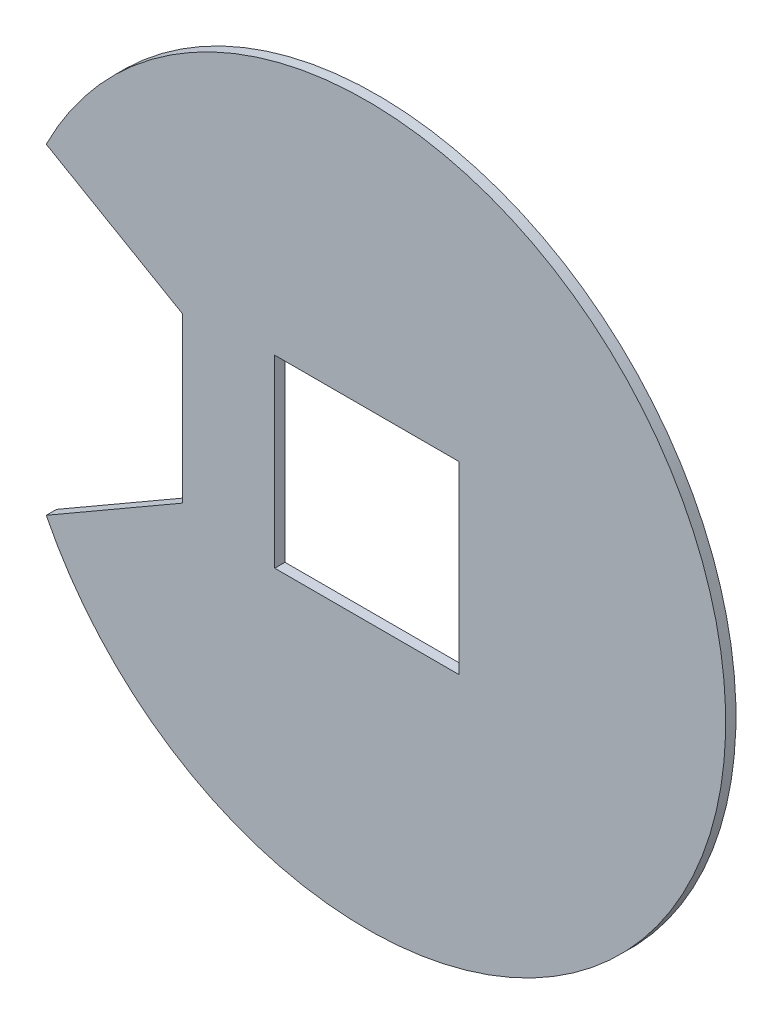
from build123d import *

# Parameters (mm, degrees)
ESQUISSE1_R             = 175
ESQUISSE1_W             = 90
ESQUISSE1_H             = 90
BOSS_EXTRU_1_DEPTH      = 5
ENL_V_START             = -10
ENL_V_MAT_EXTRU_1_DEPTH = 10


with BuildPart() as part:
    # Esquisse1 → Boss.-Extru.1 (new body)
    with BuildSketch(Plane.XY):
        Circle(ESQUISSE1_R)
        Rectangle(ESQUISSE1_W, ESQUISSE1_H, mode=Mode.SUBTRACT)
    extrude(amount=BOSS_EXTRU_1_DEPTH)

    # Esquisse2 → Enlèv. mat.-Extru.1 (cut)
    with BuildSketch(Plane.XY.offset(5).offset(ENL_V_START)):
        with BuildLine():
            Line((-156.468184794, 78.375424383), (-90, 40))
            Line((-90, 40), (-90, -40))
            Line((-90, -40), (-156.468184794, -78.375424383))
            ThreePointArc((-156.468184794, -78.375424383), (-175, 0), (-156.468184794, 78.375424383))
        make_face()
    extrude(amount=ENL_V_MAT_EXTRU_1_DEPTH, mode=Mode.SUBTRACT)


solid = part.part
